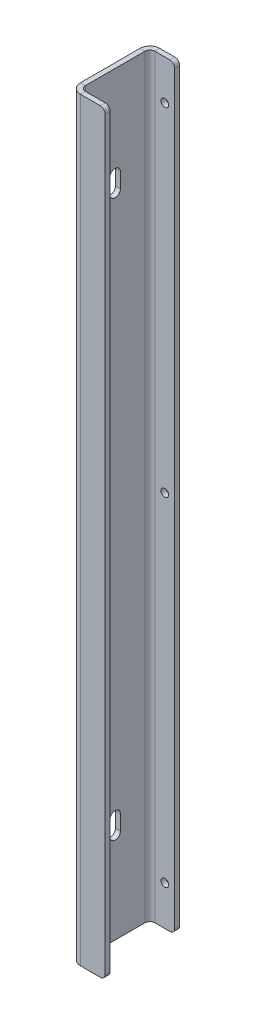
from build123d import *

# Parameters (mm, degrees)
BASE_FLANGE1_DEPTH = 482.6
SKETCH6_R          = 2.45745
CUT_EXTRUDE1_DEPTH = 3.175
FILLET1_R          = 3.175
CUT_EXTRUDE3_DEPTH = 3.175


# Sheet-metal steps are written as plain solids
with BuildPart() as part:
    # Sketch1 → Base-Flange1 (new body)
    with BuildSketch(Plane(origin=(0, 0, 0), x_dir=(1, 0, 0), z_dir=(0, 1, 0))):
        with BuildLine():
            Line((0, 0), (-15.875, 0))
            ThreePointArc((-15.875, 0), (-20.365128061, 1.859871939), (-22.225, 6.35))
            Line((-22.225, 6.35), (-22.225, 44.45))
            ThreePointArc((-22.225, 44.45), (-20.365128061, 48.940128061), (-15.875, 50.8))
            Line((-15.875, 50.8), (-3.175, 50.8))
            Line((-3.175, 50.8), (-3.175, 47.625))
            Line((-3.175, 47.625), (-15.875, 47.625))
            ThreePointArc((-15.875, 47.625), (-18.12006403, 46.69506403), (-19.05, 44.45))
            Line((-19.05, 44.45), (-19.05, 6.35))
            ThreePointArc((-19.05, 6.35), (-18.12006403, 4.10493597), (-15.875, 3.175))
            Line((-15.875, 3.175), (0, 3.175))
            Line((0, 3.175), (0, 0))
        make_face()
    extrude(amount=BASE_FLANGE1_DEPTH)

    # Sketch6 → Cut-Extrude1 (cut)
    with BuildSketch(Plane(origin=(0, 0, -50.8), x_dir=(-1, 0, 0), z_dir=(0, 0, -1))):
        with Locations((9.525, 457.2)):
            Circle(SKETCH6_R)
        with Locations((9.525, 25.4)):
            Circle(SKETCH6_R)
        with Locations((9.525, 241.3)):
            Circle(SKETCH6_R)
    extrude(amount=-CUT_EXTRUDE1_DEPTH, mode=Mode.SUBTRACT)

    # Fillet1
    fillet1_edges = [part.edges().sort_by_distance(p)[0] for p in [
        (-3.175, 0, -49.2125),
        (0, 0, -1.5875),
        (-3.175, 482.6, -49.2125),
        (0, 482.6, -1.5875),
    ]]
    fillet(fillet1_edges, radius=FILLET1_R)

    # Sketch8 → Cut-Extrude3 (cut)
    with BuildSketch(Plane.ZY.offset(22.225)):
        with BuildLine():
            Line((-22.0265625, 423.8625), (-22.0265625, 414.3375))
            ThreePointArc((-22.0265625, 414.3375), (-25.4, 410.9640625), (-28.7734375, 414.3375))
            Line((-28.7734375, 414.3375), (-28.7734375, 423.8625))
            ThreePointArc((-28.7734375, 423.8625), (-25.4, 427.2359375), (-22.0265625, 423.8625))
        make_face()
        with BuildLine():
            Line((-28.7734375, 58.7375), (-28.7734375, 68.2625))
            ThreePointArc((-28.7734375, 68.2625), (-25.4, 71.6359375), (-22.0265625, 68.2625))
            Line((-22.0265625, 68.2625), (-22.0265625, 58.7375))
            ThreePointArc((-22.0265625, 58.7375), (-25.4, 55.3640625), (-28.7734375, 58.7375))
        make_face()
    extrude(amount=-CUT_EXTRUDE3_DEPTH, mode=Mode.SUBTRACT)


solid = part.part
